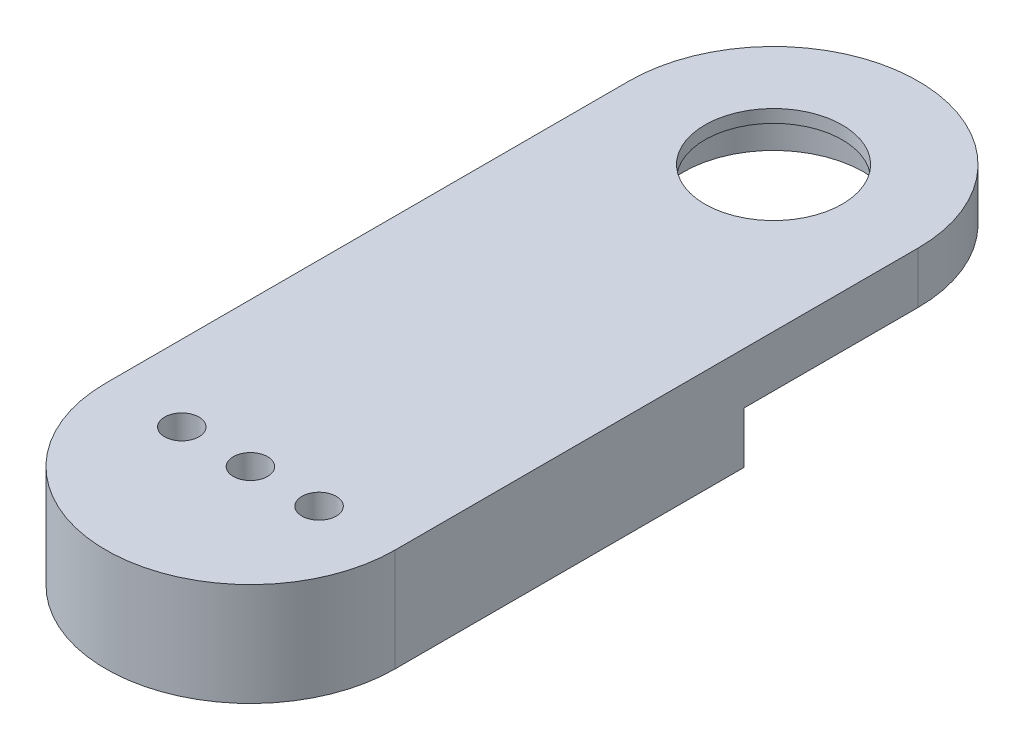
from build123d import *

# Parameters (mm, degrees)
SKETCH1_R           = 10.499999955
SKETCH1_R_2         = 2
BOSS_EXTRUDE1_DEPTH = 12
SKETCH2_R           = 10.499999955
CUT_EXTRUDE1_DEPTH  = 6
BOSS_EXTRUDE2_START = -1.5
SKETCH3_R           = 10.499999955
SKETCH3_R_2         = 8
BOSS_EXTRUDE2_DEPTH = 1.5


with BuildPart() as part:
    # Sketch1 → Boss-Extrude1 (new body)
    with BuildSketch(Plane(origin=(0, 0, 0), x_dir=(1, 0, 0), z_dir=(0, 1, 0))):
        with BuildLine():
            Line((-16.85, 0), (-16.85, 60.96))
            ThreePointArc((-16.85, 60.96), (0, 77.81), (16.85, 60.96))
            Line((16.85, 60.96), (16.85, 0))
            ThreePointArc((16.85, 0), (0, -16.85), (-16.85, 0))
        make_face()
        with Locations((0, 60.96)):
            Circle(SKETCH1_R, mode=Mode.SUBTRACT)
        with Locations((-8, 0)):
            Circle(SKETCH1_R_2, mode=Mode.SUBTRACT)
        with Locations((8, 0)):
            Circle(SKETCH1_R_2, mode=Mode.SUBTRACT)
        Circle(SKETCH1_R_2, mode=Mode.SUBTRACT)
    extrude(amount=BOSS_EXTRUDE1_DEPTH)

    # Sketch2 → Cut-Extrude1 (cut)
    with BuildSketch(Plane.XZ):
        with BuildLine():
            Line((-16.85, -40.64), (-16.85, -60.96))
            ThreePointArc((-16.85, -60.96), (0, -77.81), (16.85, -60.96))
            Line((16.85, -60.96), (16.85, -40.64))
            Line((16.85, -40.64), (-16.85, -40.64))
        make_face()
        with Locations((0, -60.96)):
            Circle(SKETCH2_R, mode=Mode.SUBTRACT)
    extrude(amount=-CUT_EXTRUDE1_DEPTH, mode=Mode.SUBTRACT)

    # Sketch3 → Boss-Extrude2 (add)
    with BuildSketch(Plane(origin=(0, 12, 0), x_dir=(1, 0, 0), z_dir=(0, 1, 0)).offset(BOSS_EXTRUDE2_START)):
        with Locations((0, 60.96)):
            Circle(SKETCH3_R)
        with Locations((0, 60.96)):
            Circle(SKETCH3_R_2, mode=Mode.SUBTRACT)
    extrude(amount=BOSS_EXTRUDE2_DEPTH)


solid = part.part
